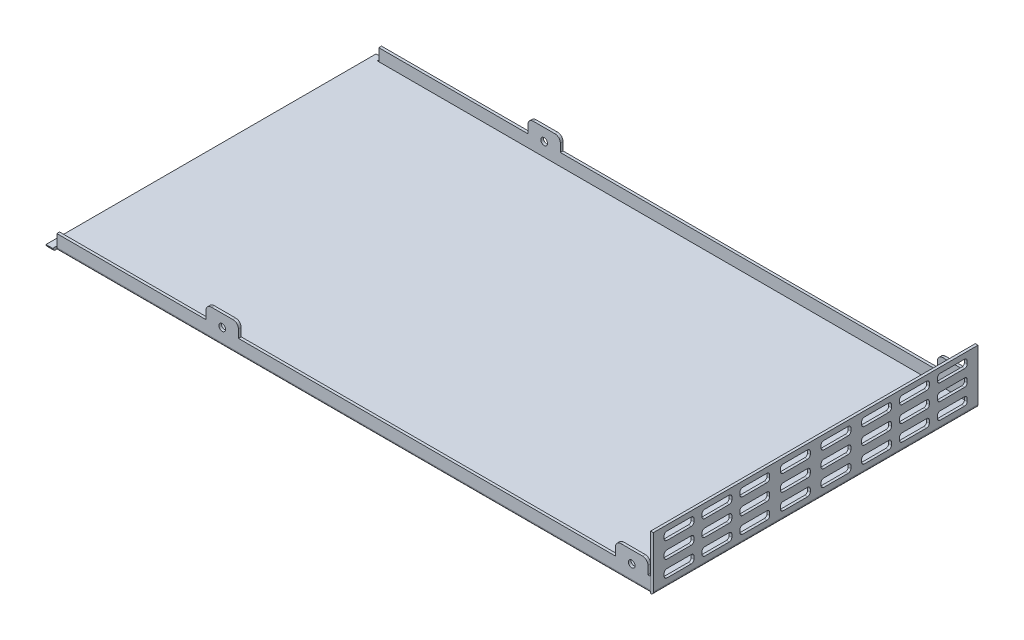
from build123d import *

# Parameters (mm, degrees)
BOSS_EXTRUDE1_DEPTH            = 1
SKETCH2_W                      = 1
SKETCH2_H                      = 120
BOSS_EXTRUDE2_DEPTH            = 19
BOSS_EXTRUDE3_DEPTH            = 1
M3X0_5_TAPPED_HOLE1_AT_2_COUNT = 2
M3X0_5_TAPPED_HOLE1_AT_2_PITCH = 151.37
SKETCH6_W                      = 0.1
SKETCH6_H                      = 5.5
CUT_EXTRUDE1_DEPTH             = 1
SKETCH7_W                      = 0.5
SKETCH7_H                      = 1
CUT_EXTRUDE2_DEPTH             = 1
FILLET2_R                      = 1
FILLET11_R                     = 1
CUT_EXTRUDE3_DEPTH             = 1
LPATTERN1_COUNT                = 3
LPATTERN1_PITCH                = 14
LPATTERN1_COUNT_DIR2           = 3
LPATTERN1_PITCH_DIR2           = 6
MIRROR8_COPY_1_DEPTH           = 1
MIRROR8_COPY_2_DEPTH           = 1
MIRROR8_COPY_3_DEPTH           = 1
MIRROR8_COPY_4_DEPTH           = 1
MIRROR8_COPY_5_DEPTH           = 1
MIRROR8_COPY_6_DEPTH           = 1
MIRROR8_COPY_7_DEPTH           = 1
MIRROR8_COPY_8_DEPTH           = 1
CUT_EXTRUDE4_DEPTH             = 1
LPATTERN2_COUNT                = 3
LPATTERN2_PITCH                = 6
FILLET12_R                     = 1


with BuildPart() as part:
    # Sketch1 → Boss-Extrude1 (new body)
    with BuildSketch(Plane(origin=(0, 0, 0), x_dir=(1, 0, 0), z_dir=(0, 1, 0))):
        Polygon((223.5, -60), (223.5, 60), (2.5, 60), (2.5, 61), (0, 61), (0, -61), (2.5, -61), (2.5, -60), align=None)
    extrude(amount=BOSS_EXTRUDE1_DEPTH)

    # Sketch2 → Boss-Extrude2 (add)
    with BuildSketch(Plane(origin=(0, 1, 0), x_dir=(1, 0, 0), z_dir=(0, 1, 0))):
        with Locations((223, 0)):
            Rectangle(SKETCH2_W, SKETCH2_H)
    extrude(amount=BOSS_EXTRUDE2_DEPTH)

    # Sketch3 → Boss-Extrude3 (add)
    with BuildSketch(Plane.XY.offset(60)):
        with BuildLine():
            Line((219.5, 10.5), (211.5, 10.5))
            ThreePointArc((211.5, 10.5), (210.085786438, 9.914213562), (209.5, 8.5))
            Line((209.5, 8.5), (209.5, 5.5))
            Line((209.5, 5.5), (70.13, 5.5))
            Line((70.13, 5.5), (70.13, 8.5))
            ThreePointArc((70.13, 8.5), (69.544213562, 9.914213562), (68.13, 10.5))
            Line((68.13, 10.5), (60.13, 10.5))
            ThreePointArc((60.13, 10.5), (58.715786438, 9.914213562), (58.13, 8.5))
            Line((58.13, 8.5), (58.13, 5.5))
            Line((58.13, 5.5), (3, 5.5))
            Line((3, 5.5), (3, 1))
            Line((3, 1), (222.5, 1))
            Line((222.5, 1), (222.5, 5.5))
            Line((222.5, 5.5), (221.5, 5.5))
            Line((221.5, 5.5), (221.5, 8.5))
            ThreePointArc((221.5, 8.5), (220.914213562, 9.914213562), (219.5, 10.5))
        make_face()
    boss_extrude3 = extrude(amount=-BOSS_EXTRUDE3_DEPTH)

    # Sketch4 → M3x0.5 Tapped Hole1 (revolve, cut)
    with BuildSketch(Plane(origin=(64.13, 6, 60), x_dir=(0, -1, 0), z_dir=(1, 0, 0))):
        Polygon((0, 0), (0, 1.751075774), (1.25, 1), (1.25, 0), align=None)
    m3x0_5_tapped_hole1 = revolve(axis=Axis((64.13, 6, 66.35), (0, 0, -1)), mode=Mode.SUBTRACT)

    # M3x0.5 Tapped Hole1 at 2: M3x0.5 Tapped Hole1 ×2
    with Locations(*[(i * M3X0_5_TAPPED_HOLE1_AT_2_PITCH, 0, 0) for i in range(1, M3X0_5_TAPPED_HOLE1_AT_2_COUNT)]):
        add(m3x0_5_tapped_hole1, mode=Mode.SUBTRACT)

    # Mirror5: Boss-Extrude3, M3x0.5 Tapped Hole1 across plane
    add(boss_extrude3.mirror(Plane.XY))
    add(m3x0_5_tapped_hole1.mirror(Plane.XY), mode=Mode.SUBTRACT)

    # Mirror5 copy 1 sketch → Mirror5 copy 1 (revolve, cut)
    with BuildSketch(Plane(origin=(215.5, 6, -60), x_dir=(0, -1, 0), z_dir=(1, 0, 0))):
        Polygon((0, 0), (0, -1.751075774), (1.25, -1), (1.25, 0), align=None)
    revolve(axis=Axis((215.5, 6, -66.35), (0, 0, -1)), mode=Mode.SUBTRACT)

    # Sketch6 → Cut-Extrude1 (cut)
    with BuildSketch(Plane.XY.offset(60)):
        with Locations((222.45, 2.75)):
            Rectangle(SKETCH6_W, SKETCH6_H)
    cut_extrude1 = extrude(amount=-CUT_EXTRUDE1_DEPTH, mode=Mode.SUBTRACT)

    # Mirror6: Cut-Extrude1 across plane
    add(cut_extrude1.mirror(Plane.XY), mode=Mode.SUBTRACT)

    # Sketch7 → Cut-Extrude2 (cut)
    with BuildSketch(Plane.XY.offset(60)):
        with Locations((2.75, 0.5)):
            Rectangle(SKETCH7_W, SKETCH7_H)
    cut_extrude2 = extrude(amount=-CUT_EXTRUDE2_DEPTH, mode=Mode.SUBTRACT)

    # Mirror7: Cut-Extrude2 across plane
    add(cut_extrude2.mirror(Plane.XY), mode=Mode.SUBTRACT)

    # Fillet2
    fillet2_edges = [part.edges().sort_by_distance(p)[0] for p in [
        (223.5, 0, 0),
    ]]
    fillet(fillet2_edges, radius=FILLET2_R)

    # Fillet11
    fillet11_edges = [part.edges().sort_by_distance(p)[0] for p in [
        (112.7, 0, -60),
        (112.7, 0, 60),
    ]]
    fillet(fillet11_edges, radius=FILLET11_R)

    # Sketch8 → Cut-Extrude3 (cut)
    with BuildSketch(Plane(origin=(223.5, 0, 0), x_dir=(0, 0, -1), z_dir=(1, 0, 0))):
        with BuildLine():
            Line((-55, 6), (-46, 6))
            ThreePointArc((-46, 6), (-45.292893219, 5.707106781), (-45, 5))
            Line((-45, 5), (-45, 4))
            ThreePointArc((-45, 4), (-45.292893219, 3.292893219), (-46, 3))
            Line((-46, 3), (-55, 3))
            ThreePointArc((-55, 3), (-55.707106781, 3.292893219), (-56, 4))
            Line((-56, 4), (-56, 5))
            ThreePointArc((-56, 5), (-55.707106781, 5.707106781), (-55, 6))
        make_face()
    cut_extrude3 = extrude(amount=-CUT_EXTRUDE3_DEPTH, mode=Mode.SUBTRACT)

    # LPattern1: Cut-Extrude3 3 × 3
    with Locations(*[(0, j * LPATTERN1_PITCH_DIR2, -i * LPATTERN1_PITCH) for i in range(LPATTERN1_COUNT) for j in range(LPATTERN1_COUNT_DIR2) if (i, j) != (0, 0)]):
        add(cut_extrude3, mode=Mode.SUBTRACT)

    # Mirror8: Cut-Extrude3 across plane
    add(cut_extrude3.mirror(Plane.XY), mode=Mode.SUBTRACT)

    # Mirror8 copy 1 sketch → Mirror8 copy 1 (cut)
    with BuildSketch(Plane(origin=(223.5, 6, 0), x_dir=(0, 0, 1), z_dir=(1, 0, 0))):
        with BuildLine():
            Line((-55, -6), (-46, -6))
            ThreePointArc((-46, -6), (-45.292893219, -5.707106781), (-45, -5))
            Line((-45, -5), (-45, -4))
            ThreePointArc((-45, -4), (-45.292893219, -3.292893219), (-46, -3))
            Line((-46, -3), (-55, -3))
            ThreePointArc((-55, -3), (-55.707106781, -3.292893219), (-56, -4))
            Line((-56, -4), (-56, -5))
            ThreePointArc((-56, -5), (-55.707106781, -5.707106781), (-55, -6))
        make_face()
    extrude(amount=-MIRROR8_COPY_1_DEPTH, mode=Mode.SUBTRACT)

    # Mirror8 copy 2 sketch → Mirror8 copy 2 (cut)
    with BuildSketch(Plane(origin=(223.5, 12, 0), x_dir=(0, 0, 1), z_dir=(1, 0, 0))):
        with BuildLine():
            Line((-55, -6), (-46, -6))
            ThreePointArc((-46, -6), (-45.292893219, -5.707106781), (-45, -5))
            Line((-45, -5), (-45, -4))
            ThreePointArc((-45, -4), (-45.292893219, -3.292893219), (-46, -3))
            Line((-46, -3), (-55, -3))
            ThreePointArc((-55, -3), (-55.707106781, -3.292893219), (-56, -4))
            Line((-56, -4), (-56, -5))
            ThreePointArc((-56, -5), (-55.707106781, -5.707106781), (-55, -6))
        make_face()
    extrude(amount=-MIRROR8_COPY_2_DEPTH, mode=Mode.SUBTRACT)

    # Mirror8 copy 3 sketch → Mirror8 copy 3 (cut)
    with BuildSketch(Plane(origin=(223.5, 0, 14), x_dir=(0, 0, 1), z_dir=(1, 0, 0))):
        with BuildLine():
            Line((-55, -6), (-46, -6))
            ThreePointArc((-46, -6), (-45.292893219, -5.707106781), (-45, -5))
            Line((-45, -5), (-45, -4))
            ThreePointArc((-45, -4), (-45.292893219, -3.292893219), (-46, -3))
            Line((-46, -3), (-55, -3))
            ThreePointArc((-55, -3), (-55.707106781, -3.292893219), (-56, -4))
            Line((-56, -4), (-56, -5))
            ThreePointArc((-56, -5), (-55.707106781, -5.707106781), (-55, -6))
        make_face()
    extrude(amount=-MIRROR8_COPY_3_DEPTH, mode=Mode.SUBTRACT)

    # Mirror8 copy 4 sketch → Mirror8 copy 4 (cut)
    with BuildSketch(Plane(origin=(223.5, 6, 14), x_dir=(0, 0, 1), z_dir=(1, 0, 0))):
        with BuildLine():
            Line((-55, -6), (-46, -6))
            ThreePointArc((-46, -6), (-45.292893219, -5.707106781), (-45, -5))
            Line((-45, -5), (-45, -4))
            ThreePointArc((-45, -4), (-45.292893219, -3.292893219), (-46, -3))
            Line((-46, -3), (-55, -3))
            ThreePointArc((-55, -3), (-55.707106781, -3.292893219), (-56, -4))
            Line((-56, -4), (-56, -5))
            ThreePointArc((-56, -5), (-55.707106781, -5.707106781), (-55, -6))
        make_face()
    extrude(amount=-MIRROR8_COPY_4_DEPTH, mode=Mode.SUBTRACT)

    # Mirror8 copy 5 sketch → Mirror8 copy 5 (cut)
    with BuildSketch(Plane(origin=(223.5, 12, 14), x_dir=(0, 0, 1), z_dir=(1, 0, 0))):
        with BuildLine():
            Line((-55, -6), (-46, -6))
            ThreePointArc((-46, -6), (-45.292893219, -5.707106781), (-45, -5))
            Line((-45, -5), (-45, -4))
            ThreePointArc((-45, -4), (-45.292893219, -3.292893219), (-46, -3))
            Line((-46, -3), (-55, -3))
            ThreePointArc((-55, -3), (-55.707106781, -3.292893219), (-56, -4))
            Line((-56, -4), (-56, -5))
            ThreePointArc((-56, -5), (-55.707106781, -5.707106781), (-55, -6))
        make_face()
    extrude(amount=-MIRROR8_COPY_5_DEPTH, mode=Mode.SUBTRACT)

    # Mirror8 copy 6 sketch → Mirror8 copy 6 (cut)
    with BuildSketch(Plane(origin=(223.5, 0, 28), x_dir=(0, 0, 1), z_dir=(1, 0, 0))):
        with BuildLine():
            Line((-55, -6), (-46, -6))
            ThreePointArc((-46, -6), (-45.292893219, -5.707106781), (-45, -5))
            Line((-45, -5), (-45, -4))
            ThreePointArc((-45, -4), (-45.292893219, -3.292893219), (-46, -3))
            Line((-46, -3), (-55, -3))
            ThreePointArc((-55, -3), (-55.707106781, -3.292893219), (-56, -4))
            Line((-56, -4), (-56, -5))
            ThreePointArc((-56, -5), (-55.707106781, -5.707106781), (-55, -6))
        make_face()
    extrude(amount=-MIRROR8_COPY_6_DEPTH, mode=Mode.SUBTRACT)

    # Mirror8 copy 7 sketch → Mirror8 copy 7 (cut)
    with BuildSketch(Plane(origin=(223.5, 6, 28), x_dir=(0, 0, 1), z_dir=(1, 0, 0))):
        with BuildLine():
            Line((-55, -6), (-46, -6))
            ThreePointArc((-46, -6), (-45.292893219, -5.707106781), (-45, -5))
            Line((-45, -5), (-45, -4))
            ThreePointArc((-45, -4), (-45.292893219, -3.292893219), (-46, -3))
            Line((-46, -3), (-55, -3))
            ThreePointArc((-55, -3), (-55.707106781, -3.292893219), (-56, -4))
            Line((-56, -4), (-56, -5))
            ThreePointArc((-56, -5), (-55.707106781, -5.707106781), (-55, -6))
        make_face()
    extrude(amount=-MIRROR8_COPY_7_DEPTH, mode=Mode.SUBTRACT)

    # Mirror8 copy 8 sketch → Mirror8 copy 8 (cut)
    with BuildSketch(Plane(origin=(223.5, 12, 28), x_dir=(0, 0, 1), z_dir=(1, 0, 0))):
        with BuildLine():
            Line((-55, -6), (-46, -6))
            ThreePointArc((-46, -6), (-45.292893219, -5.707106781), (-45, -5))
            Line((-45, -5), (-45, -4))
            ThreePointArc((-45, -4), (-45.292893219, -3.292893219), (-46, -3))
            Line((-46, -3), (-55, -3))
            ThreePointArc((-55, -3), (-55.707106781, -3.292893219), (-56, -4))
            Line((-56, -4), (-56, -5))
            ThreePointArc((-56, -5), (-55.707106781, -5.707106781), (-55, -6))
        make_face()
    extrude(amount=-MIRROR8_COPY_8_DEPTH, mode=Mode.SUBTRACT)

    # Sketch9 → Cut-Extrude4 (cut)
    with BuildSketch(Plane(origin=(223.5, 0, 0), x_dir=(0, 0, -1), z_dir=(1, 0, 0))):
        with BuildLine():
            Line((-12, 18), (-3, 18))
            ThreePointArc((-3, 18), (-2.292893219, 17.707106781), (-2, 17))
            Line((-2, 17), (-2, 16))
            ThreePointArc((-2, 16), (-2.292893219, 15.292893219), (-3, 15))
            Line((-3, 15), (-12, 15))
            ThreePointArc((-12, 15), (-12.707106781, 15.292893219), (-13, 16))
            Line((-13, 16), (-13, 17))
            ThreePointArc((-13, 17), (-12.707106781, 17.707106781), (-12, 18))
        make_face()
        with BuildLine():
            Line((3, 18), (12, 18))
            ThreePointArc((12, 18), (12.707106781, 17.707106781), (13, 17))
            Line((13, 17), (13, 16))
            ThreePointArc((13, 16), (12.707106781, 15.292893219), (12, 15))
            Line((12, 15), (3, 15))
            ThreePointArc((3, 15), (2.292893219, 15.292893219), (2, 16))
            Line((2, 16), (2, 17))
            ThreePointArc((2, 17), (2.292893219, 17.707106781), (3, 18))
        make_face()
    cut_extrude4 = extrude(amount=-CUT_EXTRUDE4_DEPTH, mode=Mode.SUBTRACT)

    # LPattern2: Cut-Extrude4 ×3
    with Locations(*[(0, -i * LPATTERN2_PITCH, 0) for i in range(1, LPATTERN2_COUNT)]):
        add(cut_extrude4, mode=Mode.SUBTRACT)

    # Fillet12
    fillet12_edges = [part.edges().sort_by_distance(p)[0] for p in [
        (1.25, 0, 61),
        (1.25, 0, -61),
    ]]
    fillet(fillet12_edges, radius=FILLET12_R - 0.0001)  # a hair under: the kernel refuses the full size


solid = part.part
